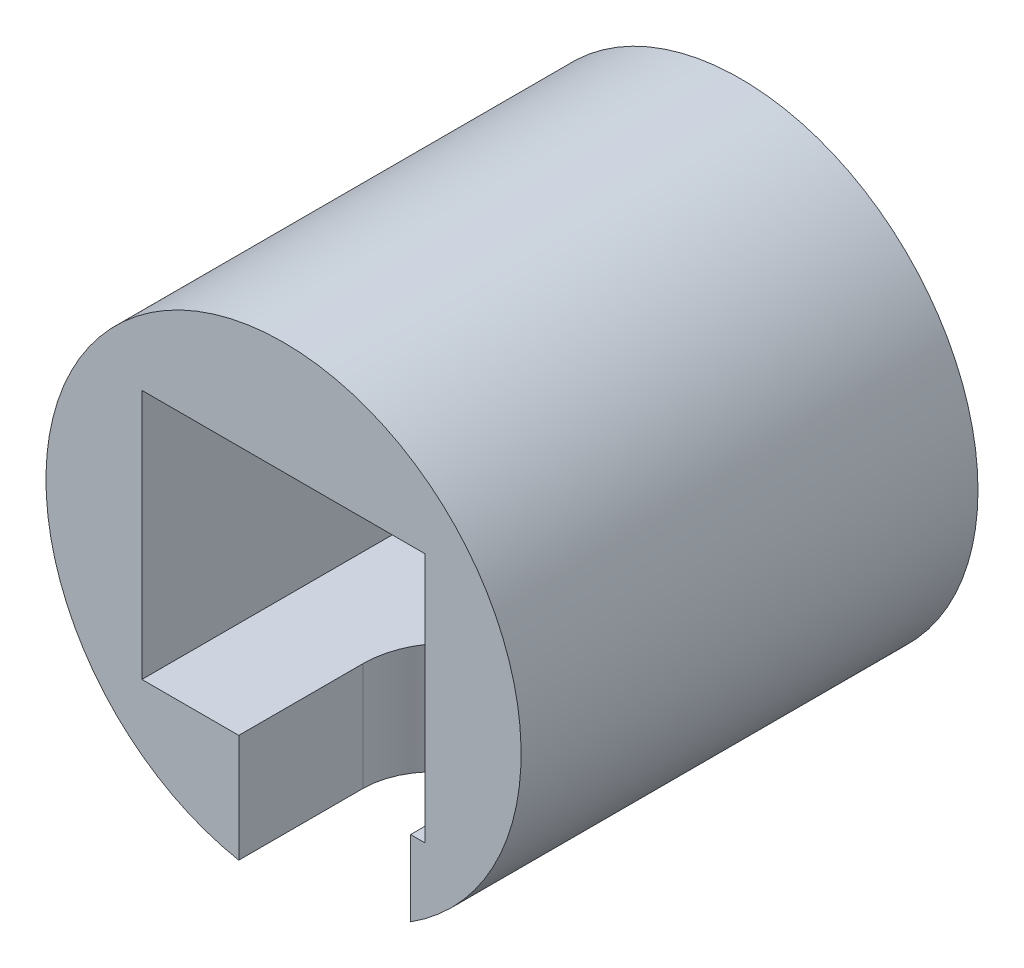
from build123d import *

# Parameters (mm, degrees)
SKETCH1_R               = 13
SKETCH1_R_2             = 3
BOSS_EXTRUDE1_DEPTH     = 25
CUT_EXTRUDE1_DEPTH      = 6.85
CUT_EXTRUDE2_REACH      = 33.032
CUT_EXTRUDE2_END_RADIUS = 13


with BuildPart() as part:
    # Sketch1 → Boss-Extrude1 (new body)
    with BuildSketch(Plane.XY):
        Circle(SKETCH1_R)
        Circle(SKETCH1_R_2, mode=Mode.SUBTRACT)
    extrude(amount=BOSS_EXTRUDE1_DEPTH)

    # Sketch2 → Cut-Extrude1 (cut, symmetric)
    with BuildSketch(Plane(origin=(0, 0, 0), x_dir=(1, 0, 0), z_dir=(0, 1, 0))):
        with BuildLine():
            Line((7.75, -25), (-7.75, -25))
            Line((-7.75, -25), (-7.75, -11.223711967))
            ThreePointArc((-7.75, -11.223711967), (-0.729296339, -6.376616895), (7.75, -7.317969182))
            Line((7.75, -7.317969182), (7.75, -25))
        make_face()
    extrude(amount=CUT_EXTRUDE1_DEPTH, both=True, mode=Mode.SUBTRACT)

    # Cut-Extrude2: up to this cylinder (the profile starts inside it)
    cut_extrude2_end = Plane(origin=(0, 0, 19.701869), z_dir=(0, 0, -1)) * Cylinder(CUT_EXTRUDE2_END_RADIUS, 93.064, mode=Mode.PRIVATE)
    # Sketch3 → Cut-Extrude2 (cut, up to the surface)
    with BuildSketch(Plane(origin=(0, 0, 0), x_dir=(1, 0, 0), z_dir=(0, 1, 0)), mode=Mode.PRIVATE) as cut_extrude2_sk1:
        with BuildLine():
            Line((-2.45, -18.2), (-2.45, -25))
            Line((-2.45, -25), (6.95, -25))
            Line((6.95, -25), (6.95, -18.2))
            ThreePointArc((6.95, -18.2), (2.25, -13.5), (-2.45, -18.2))
        make_face()
    cut_extrude2_tool1 = extrude(cut_extrude2_sk1.sketch, amount=-CUT_EXTRUDE2_REACH, mode=Mode.PRIVATE) & cut_extrude2_end
    add(cut_extrude2_tool1.solids().sort_by_distance((2.25, 0, 19.701869))[0], mode=Mode.SUBTRACT)


solid = part.part
